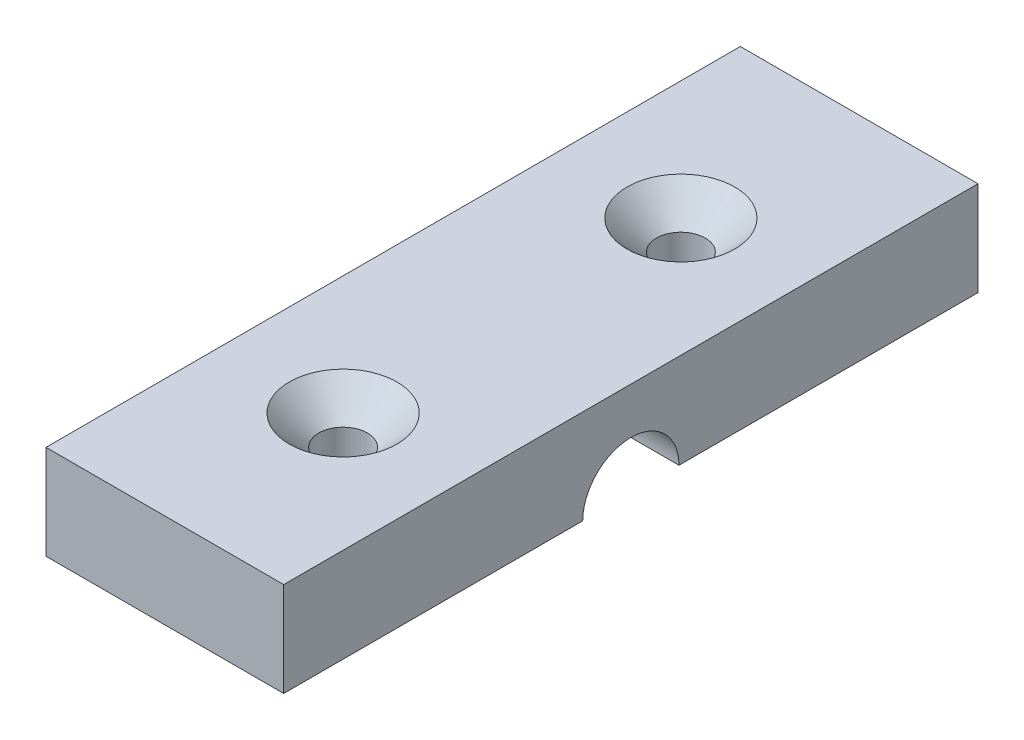
from build123d import *

# Parameters (mm, degrees)
SKETCH1_W           = 20
SKETCH1_H           = 58.42
SKETCH1_R           = 2.05
BOSS_EXTRUDE1_DEPTH = 7.9375
SKETCH2_R           = 4.05
CUT_EXTRUDE1_DEPTH  = 15
CHAMFER1_SIZE       = 2.48


with BuildPart() as part:
    # Sketch1 → Boss-Extrude1 (new body)
    with BuildSketch(Plane(origin=(0, -110.068674648, 0), x_dir=(1, 0, 0), z_dir=(0, 1, 0))):
        with Locations((78.333864278, -62.627324848)):
            Rectangle(SKETCH1_W, SKETCH1_H)
        with Locations((78.333864278, -76.837324848)):
            Circle(SKETCH1_R, mode=Mode.SUBTRACT)
        with Locations((78.333864278, -48.417324848)):
            Circle(SKETCH1_R, mode=Mode.SUBTRACT)
    extrude(amount=BOSS_EXTRUDE1_DEPTH)

    # Sketch2 → Cut-Extrude1 (cut)
    with BuildSketch(Plane(origin=(88.333864278, -1.5875, 4.936331956), x_dir=(0, 0, -1), z_dir=(1, 0, 0))):
        with Locations((-57.690992892, -108.481174648)):
            Circle(SKETCH2_R)
    extrude(amount=-CUT_EXTRUDE1_DEPTH, mode=Mode.SUBTRACT)

    # Chamfer1
    chamfer1_edges = [part.edges().sort_by_distance(p)[0] for p in [
        (76.283864278, -102.131174648, 48.417324848),
        (76.283864278, -102.131174648, 76.837324848),
    ]]
    chamfer(chamfer1_edges, length=CHAMFER1_SIZE)


solid = part.part
